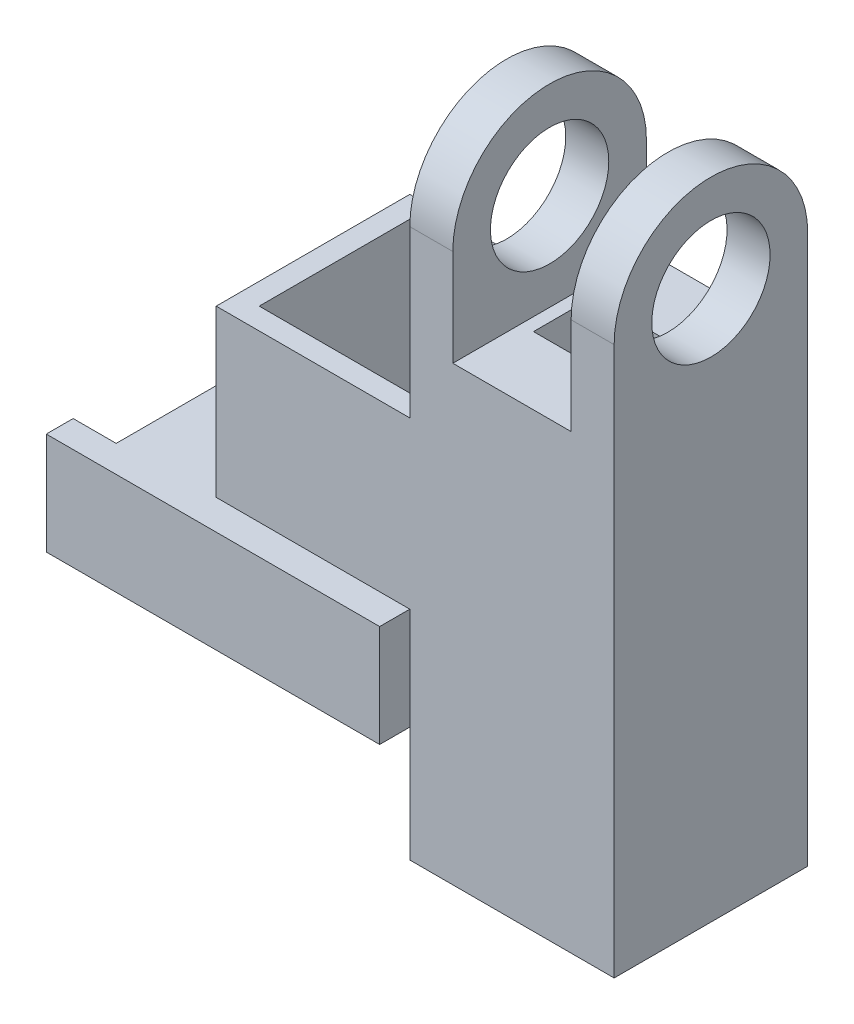
from build123d import *
from build123d.topology import SkipClean

# Parameters (mm, degrees)
SKETCH2_R                        = 5.5
BOSS_EXTRUDE1_DEPTH              = 19
CUT_EXTRUDE1_DEPTH               = 35.190641995
CUT_EXTRUDE1_DEPTH_BACK          = 35.190641995
SKETCH3_W                        = 11
SKETCH3_H                        = 18
SKETCH4_W                        = 8.5
SKETCH4_H                        = 5.5
CUT_EXTRUDE4_DEPTH               = 19
SKETCH5_W                        = 19
SKETCH5_H                        = 18
SKETCH5_R                        = 8
BOSS_EXTRUDE4_DEPTH              = 20
F_3DSKETCH1_R                    = 8
BOSS_EXTRUDE5_DEPTH              = 18
BOSS_EXTRUDE8_DEPTH              = 10
BOSS_EXTRUDE19_REACH             = 53.078
SKETCH8_W                        = 18.6
SKETCH8_H                        = 7
SKETCH8_R                        = 2.1
BOSS_EXTRUDE19_DIRECTION_2_DEPTH = 14
SKETCH8_13_W                     = 2
SKETCH8_13_H                     = 2.5
SKETCH8_13_H_2                   = 0.5
SKETCH8_13_R                     = 2.1
CUT_EXTRUDE7_DEPTH               = 10
BOSS_EXTRUDE20_DEPTH             = 18
BOSS_EXTRUDE20_DEPTH_BACK        = 10
BOSS_EXTRUDE22_START             = 3
SKETCH11_W                       = 18.6
SKETCH11_H                       = 7
SKETCH11_R                       = 2.1
BOSS_EXTRUDE22_DEPTH             = 3
BOSS_EXTRUDE23_DEPTH             = 21
SKETCH12_W                       = 18
SKETCH12_H                       = 15.4
BOSS_EXTRUDE26_DEPTH             = 18
SKETCH13_W                       = 14
SKETCH13_H                       = 14
SKETCH13_W_2                     = 2
CUT_EXTRUDE8_DEPTH               = 15.4


with BuildPart() as part:
    # Sketch2 → Boss-Extrude1 (new body)
    with BuildSketch(Plane(origin=(0, 0, 0), x_dir=(0, 0, -1), z_dir=(1, 0, 0))):
        with BuildLine():
            Line((0, 0), (18, 0))
            Line((18, 0), (18, 13))
            ThreePointArc((18, 13), (9, 22), (0, 13))
            Line((0, 13), (0, 0))
        make_face()
        with Locations((9, 13)):
            Circle(SKETCH2_R, mode=Mode.SUBTRACT)
    extrude(amount=BOSS_EXTRUDE1_DEPTH)

    # Sketch3 → Cut-Extrude1 (cut, two sides: drawn at the far end of the back side and taken through both)
    with BuildSketch(Plane.XY.offset(-CUT_EXTRUDE1_DEPTH_BACK)):
        with Locations((9.5, 13)):
            Rectangle(SKETCH3_W, SKETCH3_H)
    extrude(amount=CUT_EXTRUDE1_DEPTH + CUT_EXTRUDE1_DEPTH_BACK, mode=Mode.SUBTRACT)

    # Sketch4 → Cut-Extrude4 (cut)
    with BuildSketch(Plane(origin=(0, 0, 0), x_dir=(1, 0, 0), z_dir=(0, 1, 0))):
        with Locations((9.45, 9.05)):
            Rectangle(SKETCH4_W, SKETCH4_H)
    extrude(amount=CUT_EXTRUDE4_DEPTH, mode=Mode.SUBTRACT)

    # Sketch5 → Boss-Extrude4 (add)
    with BuildSketch(Plane.XZ):
        with Locations((9.5, -9)):
            Rectangle(SKETCH5_W, SKETCH5_H)
        with Locations(Location((9.5, -9, 0), (0, 0, 270))):
            Circle(SKETCH5_R, mode=Mode.SUBTRACT)
    extrude(amount=BOSS_EXTRUDE4_DEPTH)

    # 3DSketch1 → Boss-Extrude5 (add)
    with BuildSketch(Plane(origin=(0, -20, 0), x_dir=(0.7259526839058267, 0, -0.687744647910783), z_dir=(0, 1, 0))):
        Polygon((0, 0), (12.379403662, 13.06714831), (26.172504657, 0), (13.793100994, -13.06714831), align=None)
        with Locations(Location((13.086252328, 0, 0), (0, 0, 226.548157699))):
            Circle(F_3DSKETCH1_R, mode=Mode.SUBTRACT)
    extrude(amount=-BOSS_EXTRUDE5_DEPTH)

    # Sketch7 → Boss-Extrude8 (add)
    with BuildSketch(Plane.ZY):
        Polygon((0, -23.8), (0, -14.8), (-2, -14.8), (-2, -22.8), (-7, -22.8), (-7, -24.8), (0, -24.8), align=None)
        Polygon((-16, -14.8), (-18, -14.8), (-18, -23.8), (-18, -24.8), (-11, -24.8), (-11, -22.8), (-16, -22.8), align=None)
    extrude(amount=BOSS_EXTRUDE8_DEPTH)

    # Boss-Extrude19: up to this face of the body (flat: up to its plane)
    boss_extrude19_end = Plane(part.part.faces().sort_by_distance((0, -10.449751669, -9))[0])
    # Sketch8 → Boss-Extrude19 (add, up to the picked face)
    with BuildSketch(Plane.ZY.offset(10), mode=Mode.PRIVATE) as boss_extrude19_sk1:
        with Locations((-9, -21.3)):
            Rectangle(SKETCH8_W, SKETCH8_H)
        with Locations(Location((-14, -21.6, 0), (0, 0, 162.247209838))):
            Circle(SKETCH8_R, mode=Mode.SUBTRACT)
        with Locations(Location((-4, -21.6, 0), (0, 0, 214.849904579))):
            Circle(SKETCH8_R, mode=Mode.SUBTRACT)
    boss_extrude19_tool1 = split(extrude(boss_extrude19_sk1.sketch, amount=-BOSS_EXTRUDE19_REACH, mode=Mode.PRIVATE), bisect_by=boss_extrude19_end, keep=Keep.BOTH, mode=Mode.PRIVATE)
    add(boss_extrude19_tool1.solids().sort_by(Axis((-10, -21.218894, -9), (1, 0, 0)))[0])

    # Sketch8 → Boss-Extrude19 direction 2 (add)
    with SkipClean():  # the faces are left unmerged after this step: merging them gives an invalid solid
        with BuildSketch(Plane.ZY.offset(10)):
            with Locations((-9, -21.3)):
                Rectangle(SKETCH8_W, SKETCH8_H)
            with Locations(Location((-14, -21.6, 0), (0, 0, 162.247209838))):
                Circle(SKETCH8_R, mode=Mode.SUBTRACT)
            with Locations(Location((-4, -21.6, 0), (0, 0, 214.849904579))):
                Circle(SKETCH8_R, mode=Mode.SUBTRACT)
        extrude(amount=BOSS_EXTRUDE19_DIRECTION_2_DEPTH)
    add(part.part.scale(1), mode=Mode.REPLACE)  # the faces are merged on a copy

    # Sketch8<13> → Cut-Extrude7 (cut)
    with SkipClean():  # the faces are left unmerged after this step: merging them gives an invalid solid
        with BuildSketch(Plane.ZY.offset(10)):
            with Locations((-17, -16.55)):
                Rectangle(SKETCH8_13_W, SKETCH8_13_H)
            with Locations((-17, -15.05)):
                Rectangle(SKETCH8_13_W, SKETCH8_13_H_2)
            with Locations((-1, -16.55)):
                Rectangle(SKETCH8_13_W, SKETCH8_13_H)
            with Locations((-1, -15.05)):
                Rectangle(SKETCH8_13_W, SKETCH8_13_H_2)
            with Locations(Location((-14, -21.6, 0), (0, 0, 180))):
                Circle(SKETCH8_13_R)
            with Locations(Location((-4, -21.6, 0), (0, 0, 180))):
                Circle(SKETCH8_13_R)
        extrude(amount=-CUT_EXTRUDE7_DEPTH, mode=Mode.SUBTRACT)
    add(part.part.scale(1), mode=Mode.REPLACE)  # the faces are merged on a copy

    # Sketch8<14> → Boss-Extrude20 (add, two sides: drawn at the far end of the back side and taken through both)
    with BuildSketch(Plane.ZY.offset(10).offset(-BOSS_EXTRUDE20_DEPTH_BACK)):
        Polygon((-11, -24.8), (-18, -24.8), (-18.3, -24.8), (-18.3, -17.8), (-20.485605357, -17.8), (-20.8, -17.8), (-20.8, -27.3), (-18, -27.3), (0, -27.3), (2.8, -27.3), (2.8, -17.8), (0.3, -17.8), (0.3, -24.8), (0, -24.8), (-9, -24.8), align=None)
    extrude(amount=BOSS_EXTRUDE20_DEPTH + BOSS_EXTRUDE20_DEPTH_BACK)

    # Sketch11 → Boss-Extrude22 (add)
    with SkipClean():  # the faces are left unmerged after this step: merging them gives an invalid solid
        with BuildSketch(Plane.ZY.offset(24).offset(BOSS_EXTRUDE22_START)):
            with Locations((-9, -21.3)):
                Rectangle(SKETCH11_W, SKETCH11_H)
            with Locations(Location((-14, -21.6, 0), (0, 0, 180))):
                Circle(SKETCH11_R, mode=Mode.SUBTRACT)
            with Locations(Location((-4, -21.6, 0), (0, 0, 180))):
                Circle(SKETCH11_R, mode=Mode.SUBTRACT)
        extrude(amount=-BOSS_EXTRUDE22_DEPTH)
    add(part.part.scale(1), mode=Mode.REPLACE)  # the faces are merged on a copy

    # Sketch8<15> → Boss-Extrude23 (add)
    with BuildSketch(Plane.ZY.offset(10)):
        Polygon((-11, -24.8), (-18, -24.8), (-18.3, -24.8), (-18.3, -17.8), (-20.485605357, -17.8), (-20.8, -17.8), (-20.8, -27.3), (-18, -27.3), (0, -27.3), (2.8, -27.3), (2.8, -17.8), (0.3, -17.8), (0.3, -24.8), (0, -24.8), (-9, -24.8), align=None)
    extrude(amount=BOSS_EXTRUDE23_DEPTH)

    # Sketch12 → Boss-Extrude26 (add)
    with BuildSketch(Plane.ZY):
        with Locations((-9, -10.1)):
            Rectangle(SKETCH12_W, SKETCH12_H)
    extrude(amount=BOSS_EXTRUDE26_DEPTH)

    # Sketch13 → Cut-Extrude8 (cut)
    with BuildSketch(Plane(origin=(0, -2.4, 0), x_dir=(1, 0, 0), z_dir=(0, 1, 0))):
        with Locations((-9, 9)):
            Rectangle(SKETCH13_W, SKETCH13_H)
        with Locations((-1, 9)):
            Rectangle(SKETCH13_W_2, SKETCH13_H)
    extrude(amount=-CUT_EXTRUDE8_DEPTH, mode=Mode.SUBTRACT)


solid = part.part
